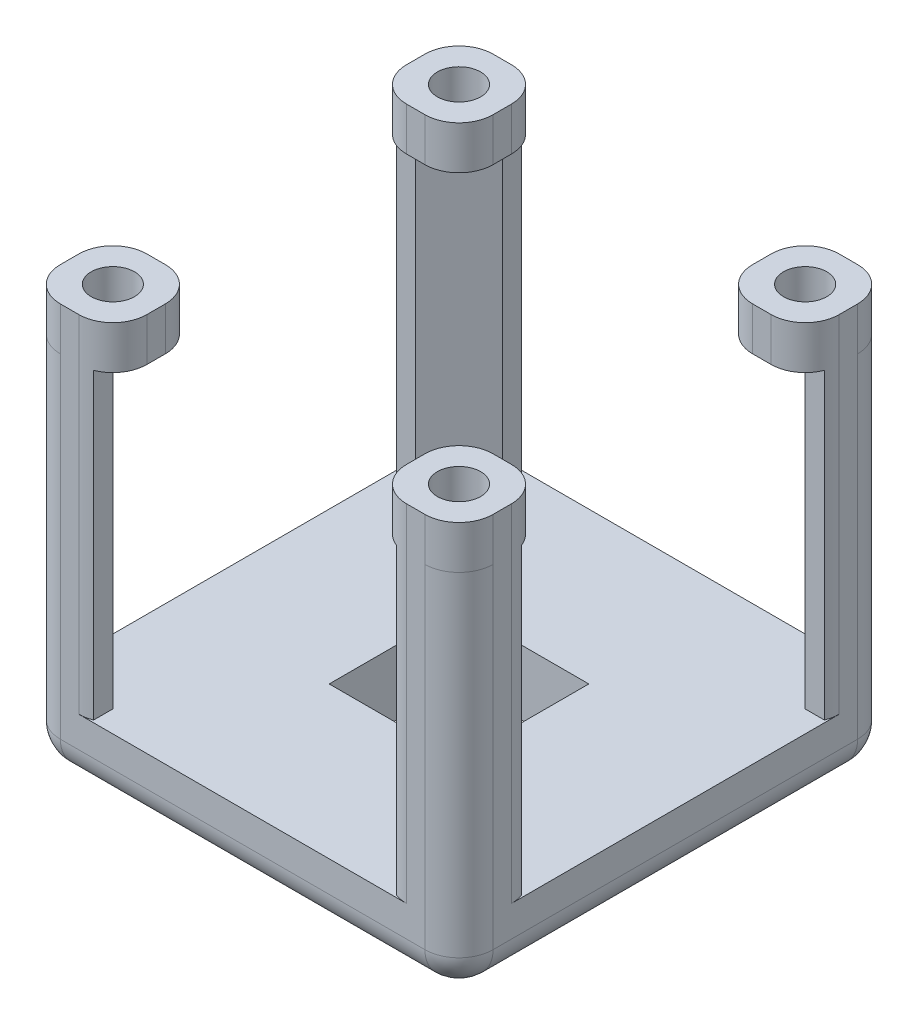
from build123d import *

# Parameters (mm, degrees)
SKETCH1_W           = 127
SKETCH1_H           = 127
BOSS_EXTRUDE1_DEPTH = 107.95
SKETCH2_W           = 88.9
SKETCH2_H           = 88.9
CUT_EXTRUDE1_DEPTH  = 179.366063196
SKETCH4_W           = 88.9
SKETCH4_H           = 88.9
CUT_EXTRUDE4_DEPTH  = 179.366063196
CUT_EXTRUDE5_REACH  = 142.42
SKETCH6_W           = 38.1
SKETCH6_H           = 38.1
FILLET1_R           = 10
CHAMFER2_SIZE       = 12.7
SKETCH7_W           = 25.4
SKETCH7_H           = 25.4
SKETCH7_R           = 6.35
BOSS_EXTRUDE2_DEPTH = 12.7
FILLET2_START       = 19.05
FILLET2_DEPTH       = 101.6


with BuildPart() as part:
    # Sketch1 → Boss-Extrude1 (new body)
    with BuildSketch(Plane(origin=(0, 0, 0), x_dir=(1, 0, 0), z_dir=(0, 1, 0))):
        Rectangle(SKETCH1_W, SKETCH1_H)
    extrude(amount=BOSS_EXTRUDE1_DEPTH)

    # Sketch2 → Cut-Extrude1 (cut, through all)
    with BuildSketch(Plane.XY.offset(63.5)):
        with Locations((0, 63.5)):
            Rectangle(SKETCH2_W, SKETCH2_H)
    extrude(amount=-CUT_EXTRUDE1_DEPTH, mode=Mode.SUBTRACT)

    # Sketch4 → Cut-Extrude4 (cut, through all)
    with BuildSketch(Plane(origin=(63.5, 0, 0), x_dir=(0, 0, -1), z_dir=(1, 0, 0))):
        with Locations((0, 63.5)):
            Rectangle(SKETCH4_W, SKETCH4_H)
    extrude(amount=-CUT_EXTRUDE4_DEPTH, mode=Mode.SUBTRACT)

    # Sketch6 → Cut-Extrude5 (cut, up to next)
    with BuildSketch(Plane.XZ, mode=Mode.PRIVATE) as cut_extrude5_sk1:
        Rectangle(SKETCH6_W, SKETCH6_H)
    cut_extrude5_tool1 = extrude(cut_extrude5_sk1.sketch, amount=-CUT_EXTRUDE5_REACH, mode=Mode.PRIVATE) & part.part
    add(cut_extrude5_tool1.solids().sort_by_distance((0, 0, 0))[0], mode=Mode.SUBTRACT)

    # Fillet1
    fillet1_edges = [part.edges().sort_by_distance(p)[0] for p in [
        (63.5, 0, 0),
        (0, 0, -63.5),
        (-63.5, 0, 0),
        (0, 0, 63.5),
        (63.5, 53.975, 63.5),
        (63.5, 53.975, -63.5),
        (-63.5, 53.975, -63.5),
        (-63.5, 53.975, 63.5),
    ]]
    fillet(fillet1_edges, radius=FILLET1_R)

    # Chamfer2
    chamfer2_edges = [part.edges().sort_by_distance(p)[0] for p in [
        (-44.45, 63.5, -44.45),
        (44.45, 63.5, -44.45),
        (-44.45, 63.5, 44.45),
        (44.45, 63.5, 44.45),
    ]]
    chamfer(chamfer2_edges, length=CHAMFER2_SIZE)

    # Sketch7 → Boss-Extrude2 (add)
    # profile 1 of 4: a face of its own
    with BuildSketch(Plane(origin=(0, 107.95, 0), x_dir=(1, 0, 0), z_dir=(0, 1, 0))):
        with Locations((50.8, 50.8)):
            Rectangle(SKETCH7_W, SKETCH7_H)
        with Locations(Location((50.8, 50.8, 0), (0, 0, 90))):
            Circle(SKETCH7_R, mode=Mode.SUBTRACT)
    # profile 2 of 4: a face of its own
    with BuildSketch(Plane(origin=(0, 107.95, 0), x_dir=(1, 0, 0), z_dir=(0, 1, 0))):
        with Locations((-50.8, 50.8)):
            Rectangle(SKETCH7_W, SKETCH7_H)
        with Locations(Location((-50.8, 50.8, 0), (0, 0, 45))):
            Circle(SKETCH7_R, mode=Mode.SUBTRACT)
    # profile 3 of 4: a face of its own
    with BuildSketch(Plane(origin=(0, 107.95, 0), x_dir=(1, 0, 0), z_dir=(0, 1, 0))):
        with Locations((-50.8, -50.8)):
            Rectangle(SKETCH7_W, SKETCH7_H)
        with Locations(Location((-50.8, -50.8, 0), (0, 0, 90))):
            Circle(SKETCH7_R, mode=Mode.SUBTRACT)
    # profile 4 of 4: a face of its own
    with BuildSketch(Plane(origin=(0, 107.95, 0), x_dir=(1, 0, 0), z_dir=(0, 1, 0))):
        with Locations((50.8, -50.8)):
            Rectangle(SKETCH7_W, SKETCH7_H)
        with Locations(Location((50.8, -50.8, 0), (0, 0, 45))):
            Circle(SKETCH7_R, mode=Mode.SUBTRACT)
    extrude(amount=BOSS_EXTRUDE2_DEPTH)

    # Fillet2: read off the stored shape, not the designer's step
    # Fillet2 outline → Fillet2 (cut)
    with BuildSketch(Plane(origin=(0, 0, 0), x_dir=(1, 0, 0), z_dir=(0, 1, 0)).offset(FILLET2_START)):
        with BuildLine():
            Line((63.5, -63.5), (63.5, -53.5))
            ThreePointArc((63.5, -53.5), (60.571067812, -60.571067812), (53.5, -63.5))
            Line((53.5, -63.5), (63.5, -63.5))
        make_face()
        with BuildLine():
            Line((63.5, -48.1), (63.5, -38.1))
            Line((63.5, -38.1), (53.5, -38.1))
            ThreePointArc((53.5, -38.1), (60.571067812, -41.028932188), (63.5, -48.1))
        make_face()
        with BuildLine():
            ThreePointArc((48.1, -63.5), (41.028932188, -60.571067812), (38.1, -53.5))
            Line((38.1, -53.5), (38.1, -63.5))
            Line((38.1, -63.5), (48.1, -63.5))
        make_face()
        with BuildLine():
            ThreePointArc((38.1, -48.1), (41.028932188, -41.028932188), (48.1, -38.1))
            Line((48.1, -38.1), (38.1, -38.1))
            Line((38.1, -38.1), (38.1, -48.1))
        make_face()
        with BuildLine():
            Line((53.5, 38.1), (63.5, 38.1))
            Line((63.5, 38.1), (63.5, 48.1))
            ThreePointArc((63.5, 48.1), (60.571067812, 41.028932188), (53.5, 38.1))
        make_face()
        with BuildLine():
            Line((-38.1, -63.5), (-38.1, -53.5))
            ThreePointArc((-38.1, -53.5), (-41.028932188, -60.571067812), (-48.1, -63.5))
            Line((-48.1, -63.5), (-38.1, -63.5))
        make_face()
        with BuildLine():
            Line((38.1, 38.1), (48.1, 38.1))
            ThreePointArc((48.1, 38.1), (41.028932188, 41.028932188), (38.1, 48.1))
            Line((38.1, 48.1), (38.1, 38.1))
        make_face()
        with BuildLine():
            ThreePointArc((-48.1, -38.1), (-41.028932188, -41.028932188), (-38.1, -48.1))
            Line((-38.1, -48.1), (-38.1, -38.1))
            Line((-38.1, -38.1), (-48.1, -38.1))
        make_face()
        with BuildLine():
            ThreePointArc((53.5, 63.5), (60.571067812, 60.571067812), (63.5, 53.5))
            Line((63.5, 53.5), (63.5, 63.5))
            Line((63.5, 63.5), (53.5, 63.5))
        make_face()
        with BuildLine():
            Line((-63.5, -63.5), (-53.5, -63.5))
            ThreePointArc((-53.5, -63.5), (-60.571067812, -60.571067812), (-63.5, -53.5))
            Line((-63.5, -53.5), (-63.5, -63.5))
        make_face()
        with BuildLine():
            Line((38.1, 63.5), (38.1, 53.5))
            ThreePointArc((38.1, 53.5), (41.028932188, 60.571067812), (48.1, 63.5))
            Line((48.1, 63.5), (38.1, 63.5))
        make_face()
        with BuildLine():
            Line((-53.5, -38.1), (-63.5, -38.1))
            Line((-63.5, -38.1), (-63.5, -48.1))
            ThreePointArc((-63.5, -48.1), (-60.571067812, -41.028932188), (-53.5, -38.1))
        make_face()
        with BuildLine():
            Line((-38.1, 53.5), (-38.1, 63.5))
            Line((-38.1, 63.5), (-48.1, 63.5))
            ThreePointArc((-48.1, 63.5), (-41.028932188, 60.571067812), (-38.1, 53.5))
        make_face()
        with BuildLine():
            Line((-63.5, 38.1), (-53.5, 38.1))
            ThreePointArc((-53.5, 38.1), (-60.571067812, 41.028932188), (-63.5, 48.1))
            Line((-63.5, 48.1), (-63.5, 38.1))
        make_face()
        with BuildLine():
            Line((-38.1, 38.1), (-38.1, 48.1))
            ThreePointArc((-38.1, 48.1), (-41.028932188, 41.028932188), (-48.1, 38.1))
            Line((-48.1, 38.1), (-38.1, 38.1))
        make_face()
        with BuildLine():
            ThreePointArc((-63.5, 53.5), (-60.571067812, 60.571067812), (-53.5, 63.5))
            Line((-53.5, 63.5), (-63.5, 63.5))
            Line((-63.5, 63.5), (-63.5, 53.5))
        make_face()
    extrude(amount=FILLET2_DEPTH, mode=Mode.SUBTRACT)


solid = part.part
